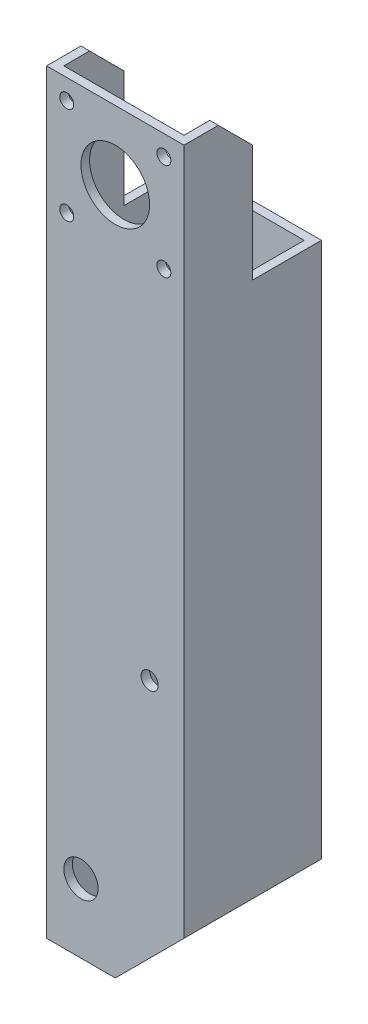
from build123d import *

# Parameters (mm, degrees)
SKETCH1_W           = 50.8
SKETCH1_H           = 50.8
SKETCH1_W_2         = 44.45
SKETCH1_H_2         = 44.45
BOSS_EXTRUDE1_DEPTH = 279.4
SKETCH2_R           = 6.35
SKETCH2_R_2         = 12.7
CUT_EXTRUDE1_DEPTH  = 289.488543967
CHAMFER1_SIZE       = 25.4
SKETCH3_R           = 3.175
CUT_EXTRUDE2_DEPTH  = 289.488543967
SKETCH4_W           = 25.4
SKETCH4_H           = 55.88
CUT_EXTRUDE3_DEPTH  = 289.488543967
CHAMFER2_SIZE       = 12.7
CUT_EXTRUDE5_REACH  = 290.489
SKETCH6_R           = 2.5796875


with BuildPart() as part:
    # Sketch1 → Boss-Extrude1 (new body)
    with BuildSketch(Plane(origin=(0, 0, 0), x_dir=(1, 0, 0), z_dir=(0, 1, 0))):
        with Locations((25.4, 25.4)):
            Rectangle(SKETCH1_W, SKETCH1_H)
        with Locations((25.4, 25.4)):
            Rectangle(SKETCH1_W_2, SKETCH1_H_2, mode=Mode.SUBTRACT)
    extrude(amount=BOSS_EXTRUDE1_DEPTH)

    # Sketch2 → Cut-Extrude1 (cut, through all)
    with BuildSketch(Plane(origin=(0, 0, -50.8), x_dir=(-1, 0, 0), z_dir=(0, 0, -1))):
        with Locations((-12.7, 25.4)):
            Circle(SKETCH2_R)
        with Locations((-25.4, 254)):
            Circle(SKETCH2_R_2)
    extrude(amount=-CUT_EXTRUDE1_DEPTH, mode=Mode.SUBTRACT)

    # Chamfer1
    # the kernel refuses this chamfer: 25.4 mm, written as the material it takes off along each edge
    with BuildSketch(Plane(origin=(50.8, 0, 65.320747894), x_dir=(-0.9996219169112966, -0.02749587661058637, 0), z_dir=(0, 0, -1))) as chamfer1_piece_1:
        Polygon((CHAMFER1_SIZE * 0.999621916911, CHAMFER1_SIZE * 0.0274958766106), (-CHAMFER1_SIZE * 0.0274958766106, CHAMFER1_SIZE * 0.999621916911), (0, 0), align=None)
    extrude(amount=181.441495789, mode=Mode.SUBTRACT)

    # Sketch3 → Cut-Extrude2 (cut, through all)
    with BuildSketch(Plane(origin=(0, 0, -50.8), x_dir=(-1, 0, 0), z_dir=(0, 0, -1))):
        with Locations((-38.1, 101.6)):
            Circle(SKETCH3_R)
    extrude(amount=-CUT_EXTRUDE2_DEPTH, mode=Mode.SUBTRACT)

    # Sketch4 → Cut-Extrude3 (cut, through all)
    with BuildSketch(Plane.ZY):
        with Locations((-38.1, 251.46)):
            Rectangle(SKETCH4_W, SKETCH4_H)
    extrude(amount=-CUT_EXTRUDE3_DEPTH, mode=Mode.SUBTRACT)

    # Chamfer2
    chamfer2_edges = [part.edges().sort_by_distance(p)[0] for p in [
        (49.2125, 279.4, -25.4),
        (1.5875, 279.4, -25.4),
    ]]
    chamfer(chamfer2_edges, length=CHAMFER2_SIZE)

    # Sketch6 → Cut-Extrude5 (cut, up to next)
    with BuildSketch(Plane.XY, mode=Mode.PRIVATE) as cut_extrude5_sk1:
        with Locations((7.439487758, 271.960512242)):
            Circle(SKETCH6_R)
    cut_extrude5_tool1 = extrude(cut_extrude5_sk1.sketch, amount=-CUT_EXTRUDE5_REACH, mode=Mode.PRIVATE) & part.part
    # Sketch6 → Cut-Extrude5 (cut, up to next)
    with BuildSketch(Plane.XY, mode=Mode.PRIVATE) as cut_extrude5_sk2:
        with Locations((7.439487758, 236.039487758)):
            Circle(SKETCH6_R)
    cut_extrude5_tool2 = extrude(cut_extrude5_sk2.sketch, amount=-CUT_EXTRUDE5_REACH, mode=Mode.PRIVATE) & part.part
    # Sketch6 → Cut-Extrude5 (cut, up to next)
    with BuildSketch(Plane.XY, mode=Mode.PRIVATE) as cut_extrude5_sk3:
        with Locations((43.360512242, 236.039487758)):
            Circle(SKETCH6_R)
    cut_extrude5_tool3 = extrude(cut_extrude5_sk3.sketch, amount=-CUT_EXTRUDE5_REACH, mode=Mode.PRIVATE) & part.part
    # Sketch6 → Cut-Extrude5 (cut, up to next)
    with BuildSketch(Plane.XY, mode=Mode.PRIVATE) as cut_extrude5_sk4:
        with Locations((43.360512242, 271.960512242)):
            Circle(SKETCH6_R)
    cut_extrude5_tool4 = extrude(cut_extrude5_sk4.sketch, amount=-CUT_EXTRUDE5_REACH, mode=Mode.PRIVATE) & part.part
    add(cut_extrude5_tool1.solids().sort_by_distance((7.439488, 271.960512, 0))[0], mode=Mode.SUBTRACT)
    add(cut_extrude5_tool2.solids().sort_by_distance((7.439488, 236.039488, 0))[0], mode=Mode.SUBTRACT)
    add(cut_extrude5_tool3.solids().sort_by_distance((43.360512, 236.039488, 0))[0], mode=Mode.SUBTRACT)
    add(cut_extrude5_tool4.solids().sort_by_distance((43.360512, 271.960512, 0))[0], mode=Mode.SUBTRACT)


solid = part.part
